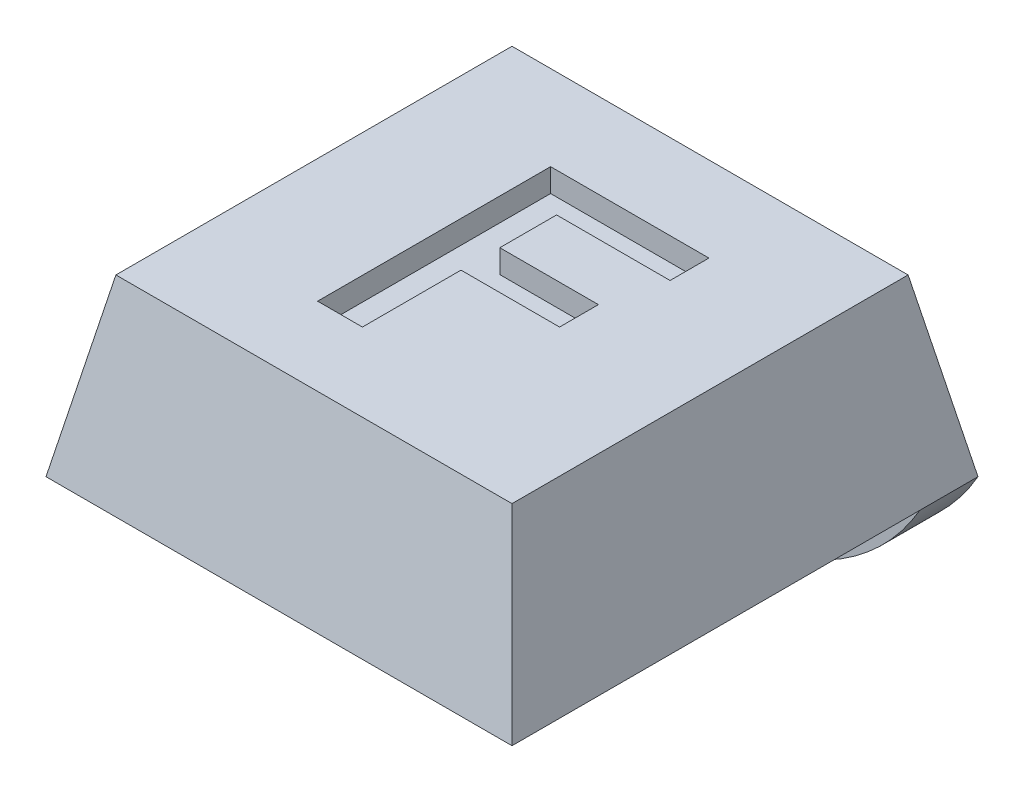
from build123d import *

# Parameters (mm, degrees)
SKETCH1_W               = 8
SKETCH1_H               = 8
BOSS_EXTRUDE1_DEPTH     = 3
CUT_EXTRUDE1_DEPTH      = 12.704699911
CUT_EXTRUDE1_DEPTH_BACK = 12.704699911
CUT_EXTRUDE2_DEPTH      = 11
SKETCH4_R               = 1.8
CUT_EXTRUDE3_DEPTH      = 0.8
SKETCH5_W               = 8
SKETCH5_H               = 1
BOSS_EXTRUDE2_DEPTH     = 2
FILLET1_R               = 4
CUT_EXTRUDE4_DEPTH      = 0.4


with BuildPart() as part:
    # Sketch1 → Boss-Extrude1 (new body)
    with BuildSketch(Plane(origin=(0, 0, 0), x_dir=(1, 0, 0), z_dir=(0, 1, 0))):
        with Locations((4, 4)):
            Rectangle(SKETCH1_W, SKETCH1_H)
    extrude(amount=BOSS_EXTRUDE1_DEPTH)

    # Sketch2 → Cut-Extrude1 (cut, two sides: drawn at the far end of the back side and taken through both)
    with BuildSketch(Plane.XY.offset(-CUT_EXTRUDE1_DEPTH_BACK)):
        Polygon((0, 0), (0.6, 3), (0, 3), align=None)
        Polygon((8, 0), (7.4, 3), (8, 3), align=None)
    extrude(amount=CUT_EXTRUDE1_DEPTH + CUT_EXTRUDE1_DEPTH_BACK, mode=Mode.SUBTRACT)

    # Sketch3 → Cut-Extrude2 (cut)
    with BuildSketch(Plane(origin=(0, 0, 0), x_dir=(0, 0, -1), z_dir=(1, 0, 0))):
        Polygon((0, 0), (0.6, 3), (0, 3), align=None)
        Polygon((8, 3), (7.4, 3), (8, 0), align=None)
    extrude(amount=CUT_EXTRUDE2_DEPTH, mode=Mode.SUBTRACT)

    # Sketch4 → Cut-Extrude3 (cut)
    with BuildSketch(Plane.XZ):
        with Locations(Location((4, -3.75, 0), (0, 0, 270))):
            Circle(SKETCH4_R)
    extrude(amount=-CUT_EXTRUDE3_DEPTH, mode=Mode.SUBTRACT)

    # Sketch5 → Boss-Extrude2 (add)
    with BuildSketch(Plane.XZ):
        with Locations((4, -7.5)):
            Rectangle(SKETCH5_W, SKETCH5_H)
    extrude(amount=BOSS_EXTRUDE2_DEPTH)

    # Fillet1
    # the kernel refuses this fillet: 4 mm, written as the material it takes off along each edge
    with BuildSketch(Plane(origin=(8, -2, -16.660254038), x_dir=(0, 1, 0), z_dir=(0, 0, 1)), Plane(origin=(0, -2, 1.660254038), x_dir=(0, 1, 0), z_dir=(0, 0, -1))) as fillet1_piece_1:
        with BuildLine():
            CenterArc((4, 3.464101615), FILLET1_R, 180, 60)
            Line((0, 3.464101615), (-0.08, 3.464101615))
            Line((-0.08, 3.464101615), (-0.08, 0))
            Line((-0.08, 0), (0, -0.08))
            ThreePointArc((0, -0.08), (1, -0.08), (1.96, -0.069282032))
            Line((1.96, -0.069282032), (2, 0))
        make_face()
    extrude(amount=18.320508076, mode=Mode.SUBTRACT)

    # Sketch6 → Cut-Extrude4 (cut)
    with BuildSketch(Plane(origin=(0, 3, 0), x_dir=(1, 0, 0), z_dir=(0, 1, 0))):
        Polygon((2.721575188, 1.941169366), (2.721575188, 5.941169366), (5.439523906, 5.941169366), (5.439523906, 5.2745027), (3.490805957, 5.2745027), (3.490805957, 4.300143725), (5.18311365, 4.300143725), (5.18311365, 3.633477059), (3.490805957, 3.633477059), (3.490805957, 1.941169366), align=None)
    extrude(amount=-CUT_EXTRUDE4_DEPTH, mode=Mode.SUBTRACT)


solid = part.part
